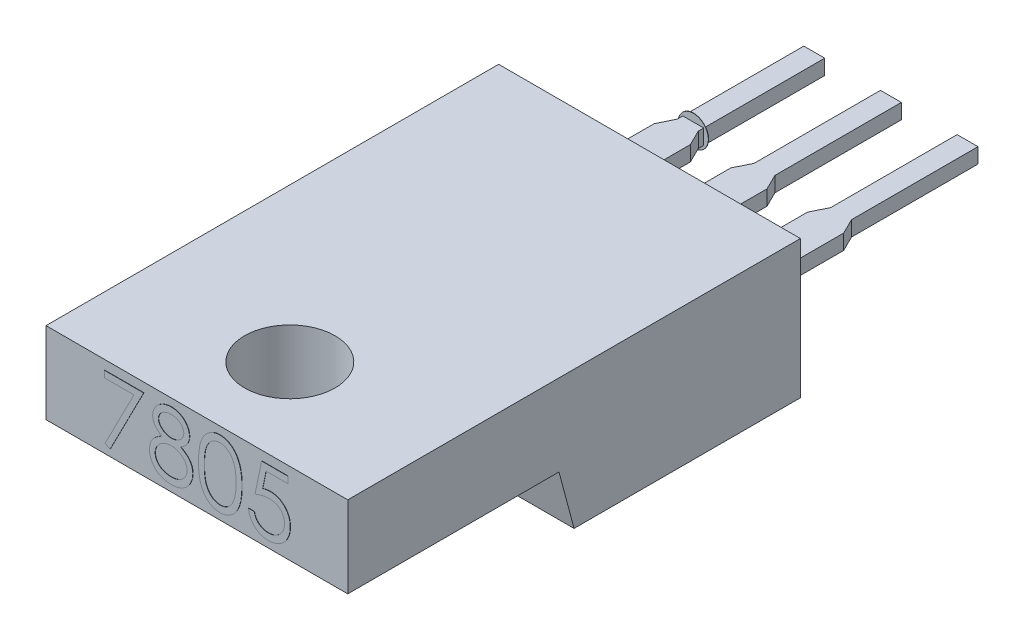
from build123d import *

# Parameters (mm, degrees)
SKETCH4_W                = 10
SKETCH4_H                = 15
BASE_EXTRUDE_DEPTH       = 4.572
CUT_EXTRUDE1_DEPTH       = 22.538261884
CUT_EXTRUDE1_DEPTH_BACK  = 22.538261884
SKETCH6_R                = 1.5
CUT_EXTRUDE2_DEPTH       = 21.414644254
BASE_FLANGIA1_DEPTH      = 0.5
SCHIZZO4_W               = 15.810041558
SCHIZZO4_H               = 21.877993277
TAGLIO_ESTRUSIONE1_DEPTH = 10
SCHIZZO5_R               = 0.5
SCHIZZO5_W               = 0.692
SCHIZZO5_H               = 0.5
ESTRUSIONE1_DEPTH        = 0.01
ESTRUSIONE2_DEPTH        = 0.01


# Sheet-metal steps are written as plain solids
with BuildPart() as part:
    # Sketch4 → Base-Extrude (new body)
    with BuildSketch(Plane(origin=(0, -1.397, 0), x_dir=(1, 0, 0), z_dir=(0, 1, 0))):
        with Locations((2.46, -11.31)):
            Rectangle(SKETCH4_W, SKETCH4_H)
    extrude(amount=BASE_EXTRUDE_DEPTH)

    # Sketch5 → Cut-Extrude1 (cut, two sides: drawn at the far end of the back side and taken through both)
    with BuildSketch(Plane.ZY.offset(2.54).offset(-CUT_EXTRUDE1_DEPTH_BACK)):
        Polygon((59.29212591, 0.475), (18.81, 0.475), (11.81, 0.475), (11.31, -1.397), (0.863664483, -40.508080175), (47.356906836, -106.792229776), (105.785368263, -65.809149601), align=None)
    extrude(amount=CUT_EXTRUDE1_DEPTH + CUT_EXTRUDE1_DEPTH_BACK, mode=Mode.SUBTRACT)

    # Sketch6 → Cut-Extrude2 (cut, through all)
    with BuildSketch(Plane.XZ.offset(-0.475)):
        with Locations(Location((2.54, 15.81, 0), (0, 0, 270))):
            Circle(SKETCH6_R)
    extrude(amount=-CUT_EXTRUDE2_DEPTH, mode=Mode.SUBTRACT)


with BuildPart() as body_2:
    # Schizzo1 → Base-Flangia1 (new body)
    with BuildSketch(Plane.XZ.offset(-0.254)):
        Polygon((2.114, -9.999924476), (2.114, 7.5524e-05), (1.86, 0.517), (1.86, 3.81), (1.86, 4.559138727), (0.52, 4.559138727), (0.52, 3.81), (0.52, 0.517), (0.266, 7.5524e-05), (0.266, -9.999924476), (-0.426, -9.999924476), (-0.426, 7.5524e-05), (-0.68, 0.517), (-0.68, 3.81), (-0.68, 5.228555054), (5.6, 5.228555054), (5.6, 3.81), (5.6, 0.517), (5.346, 7.5524e-05), (5.346, -9.999924476), (4.654, -9.999924476), (4.654, 7.5524e-05), (4.4, 0.517), (4.4, 3.81), (4.4, 4.676576991), (3.06, 4.676576991), (3.06, 3.81), (3.06, 0.517), (2.806, 7.5524e-05), (2.806, -9.999924476), align=None)
    extrude(amount=-BASE_FLANGIA1_DEPTH)

    # Schizzo4 → Taglio-Estrusione1 (cut)
    with BuildSketch(Plane(origin=(0, 0, -4.19), x_dir=(-1, 0, 0), z_dir=(0, 0, -1))):
        with Locations((-1.391629537, 1.771326868)):
            Rectangle(SCHIZZO4_W, SCHIZZO4_H)
    extrude(amount=TAGLIO_ESTRUSIONE1_DEPTH, mode=Mode.SUBTRACT)


with BuildPart() as part_1:
    add(part.part)

    # Abbina3: union body 2
    add(body_2.part)

    # Schizzo5 → Estrusione1 (add)
    with BuildSketch(Plane(origin=(0, 0, -0.19), x_dir=(-1, 0, 0), z_dir=(0, 0, -1))):
        with Locations((0.08, 0.504)):
            Circle(SCHIZZO5_R)
        with Locations((0.08, 0.504)):
            Rectangle(SCHIZZO5_W, SCHIZZO5_H, mode=Mode.SUBTRACT)
    extrude(amount=-ESTRUSIONE1_DEPTH)

    # Schizzo6 → Estrusione2 (add)
    # profile 1 of 4: a face of its own
    with BuildSketch(Plane.XY.offset(18.81)):
        Polygon((-0.595960558, 2.871521387), (0.706603545, 2.871521387), (-0.406003293, 0.700581216), (-0.570095841, 0.79089572), (0.385202637, 2.65442737), (-0.595960558, 2.65442737), align=None)
    # profile 2 of 4: a face of its own
    with BuildSketch(Plane.XY.offset(18.81)):
        with BuildLine():
            add(Edge.make_bspline(
                [(1.925637332, 1.934031403), (1.942962882, 1.924997497), (1.976753491, 1.907378361), (2.024878755, 1.87900848), (2.068860065, 1.849108468), (2.10991769, 1.819090591), (2.147330288, 1.787805259), (2.180679528, 1.755128065), (2.210789184, 1.721874659), (2.237052049, 1.687481947), (2.26015204, 1.652041297), (2.280116522, 1.615459689), (2.297181212, 1.577817292), (2.310705465, 1.538703209), (2.321846263, 1.498692003), (2.329511986, 1.457267033), (2.333634598, 1.414701265), (2.334414023, 1.385933768), (2.334808673, 1.371367808)],
                knots=[0, 0, 0, 0, 1.272397273, 2.481599622, 3.635517121, 4.734568067, 5.792894095, 6.808321871, 7.773003508, 8.711915296, 9.623354172, 10.525449501, 11.423591555, 12.311487226, 13.218079475, 14.126165749, 15.051214107, 16, 16, 16, 16], degree=3))
            add(Edge.make_bspline(
                [(2.334808673, 1.371367808), (2.334342147, 1.350988703), (2.333418718, 1.310650808), (2.325375394, 1.25111435), (2.313332783, 1.193291987), (2.295746602, 1.137196395), (2.27293898, 1.083137107), (2.24483156, 1.031067849), (2.213014307, 0.980135219), (2.187461763, 0.948796819), (2.174532231, 0.932939656)],
                knots=[0, 0, 0, 0, 1.025265484, 2.029385089, 3.018602448, 3.995076438, 4.983346944, 5.966715145, 6.97116228, 8, 8, 8, 8], degree=3))
            add(Edge.make_bspline(
                [(2.174532231, 0.932939656), (2.157697791, 0.914437707), (2.124236941, 0.877662443), (2.066915837, 0.829916001), (2.004007364, 0.789790415), (1.935754944, 0.757089793), (1.862341021, 0.731637868), (1.783781237, 0.713348346), (1.69992244, 0.7028724), (1.642285322, 0.701358083), (1.612716659, 0.700581216)],
                knots=[0, 0, 0, 0, 0.954267603, 1.896743057, 2.838368354, 3.796610408, 4.779680527, 5.799409237, 6.871065594, 8, 8, 8, 8], degree=3))
            add(Edge.make_bspline(
                [(1.612716659, 0.700581216), (1.584284753, 0.701278191), (1.52895915, 0.702634433), (1.448430339, 0.711823447), (1.373365435, 0.727926966), (1.303327978, 0.749967277), (1.238740196, 0.778639177), (1.17978613, 0.814325215), (1.125615204, 0.855588992), (1.077871385, 0.903615601), (1.035484564, 0.955055362), (0.998250551, 1.008124193), (0.967302418, 1.062826937), (0.941099841, 1.118347931), (0.921041084, 1.175465367), (0.907148367, 1.233885375), (0.898325305, 1.293505914), (0.897151381, 1.333741723), (0.89656081, 1.353983326)],
                knots=[0, 0, 0, 0, 1.256902934, 2.445805442, 3.576955095, 4.645999104, 5.686449165, 6.692658513, 7.68621702, 8.689161843, 9.678783111, 10.630372946, 11.551080876, 12.453998257, 13.34127905, 14.221779781, 15.105423033, 16, 16, 16, 16], degree=3))
            add(Edge.make_bspline(
                [(0.89656081, 1.353983326), (0.89691029, 1.36883579), (0.897600987, 1.398189501), (0.902381538, 1.441556571), (0.910067131, 1.483766614), (0.920504993, 1.52497554), (0.934650995, 1.564883338), (0.951730761, 1.603679101), (0.971646751, 1.641406627), (0.994676789, 1.678272236), (1.021468966, 1.71375937), (1.05180603, 1.748470281), (1.086294312, 1.781866363), (1.124550135, 1.814355639), (1.166136309, 1.846514442), (1.212133006, 1.876604811), (1.261320872, 1.906757009), (1.29627938, 1.924783948), (1.314212385, 1.934031403)],
                knots=[0, 0, 0, 0, 0.941657376, 1.861047343, 2.762797495, 3.66048619, 4.553285746, 5.444104102, 6.34607688, 7.256116206, 8.197091036, 9.162375105, 10.176350973, 11.237807142, 12.343728897, 13.50695164, 14.721116704, 16, 16, 16, 16], degree=3))
            add(Edge.make_bspline(
                [(1.314212385, 1.934031403), (1.289664268, 1.947417668), (1.242132243, 1.973337224), (1.179195009, 2.020960292), (1.125134966, 2.072539113), (1.081438065, 2.129162846), (1.047043908, 2.189062623), (1.023446942, 2.251863671), (1.007483354, 2.316401511), (1.005902007, 2.360492401), (1.005107818, 2.382635837)],
                knots=[0, 0, 0, 0, 1.166880483, 2.259407225, 3.286803203, 4.280235371, 5.237608625, 6.161067461, 7.076446754, 8, 8, 8, 8], degree=3))
            add(Edge.make_bspline(
                [(1.005107818, 2.382635837), (1.00609686, 2.405191979), (1.008085008, 2.45053376), (1.024161587, 2.518028891), (1.050359913, 2.584320814), (1.085993088, 2.649088221), (1.13037488, 2.710139065), (1.183622077, 2.76489478), (1.244463118, 2.812859344), (1.312594305, 2.853122077), (1.385913361, 2.885890289), (1.463271918, 2.908495336), (1.543322131, 2.923273368), (1.597809799, 2.924946535), (1.625437012, 2.925794892)],
                knots=[0, 0, 0, 0, 0.888701115, 1.786444228, 2.72001202, 3.692817113, 4.693886446, 5.687152267, 6.695133018, 7.739871481, 8.800368666, 9.853104506, 10.91144658, 12, 12, 12, 12], degree=3))
            add(Edge.make_bspline(
                [(1.625437012, 2.925794892), (1.652351223, 2.924920198), (1.705422983, 2.923195403), (1.78343402, 2.908810005), (1.858076684, 2.884783105), (1.929093571, 2.852188118), (1.99521332, 2.812039825), (2.053634716, 2.763416439), (2.105240611, 2.708902263), (2.147927364, 2.647869932), (2.183102064, 2.583351396), (2.207595466, 2.515846347), (2.223290231, 2.446813345), (2.225269837, 2.400102743), (2.226261664, 2.376699673)],
                knots=[0, 0, 0, 0, 1.072916533, 2.115669174, 3.151510826, 4.193348718, 5.225979165, 6.227137561, 7.216255879, 8.211077061, 9.189680878, 10.138522389, 11.067357538, 12, 12, 12, 12], degree=3))
            add(Edge.make_bspline(
                [(2.226261664, 2.376699673), (2.225394097, 2.353732833), (2.223690243, 2.308627265), (2.209357423, 2.242873608), (2.185219371, 2.181295518), (2.152263377, 2.123194256), (2.109309868, 2.069623541), (2.056932206, 2.019902152), (1.995547978, 1.973621641), (1.9494283, 1.947504173), (1.925637332, 1.934031403)],
                knots=[0, 0, 0, 0, 0.975232327, 1.915300861, 2.843280834, 3.77672583, 4.742871857, 5.749627742, 6.839139064, 8, 8, 8, 8], degree=3))
        make_face()
        with BuildLine():
            add(Edge.make_bspline(
                [(1.614836718, 2.708700874), (1.599989326, 2.708306908), (1.570941335, 2.707536137), (1.528348757, 2.703509247), (1.487846421, 2.695675635), (1.449011151, 2.685250319), (1.412375393, 2.671166631), (1.377441591, 2.654599173), (1.344804291, 2.634456934), (1.314069503, 2.611862304), (1.286401177, 2.58701088), (1.261845091, 2.561118774), (1.241447612, 2.533677466), (1.22412656, 2.505369553), (1.21155869, 2.475354871), (1.202145992, 2.444553636), (1.195783056, 2.412576618), (1.195306267, 2.390722633), (1.195065083, 2.379667755)],
                knots=[0, 0, 0, 0, 1.203892937, 2.355340988, 3.463153438, 4.544400666, 5.610487187, 6.640501085, 7.674077295, 8.714426146, 9.728707835, 10.68524104, 11.601827946, 12.495867327, 13.368432065, 14.231010473, 15.105153427, 16, 16, 16, 16], degree=3))
            add(Edge.make_bspline(
                [(1.195065083, 2.379667755), (1.195480776, 2.368612399), (1.196302246, 2.346765428), (1.202655347, 2.31450388), (1.212124017, 2.282801271), (1.227031798, 2.252411435), (1.244912405, 2.222280165), (1.266981059, 2.193160525), (1.293281567, 2.164951173), (1.322931495, 2.137892044), (1.355232758, 2.112553269), (1.389452632, 2.090556154), (1.42516164, 2.072150764), (1.461992892, 2.056832504), (1.500321762, 2.04492478), (1.539913391, 2.036477075), (1.580774433, 2.031226534), (1.608460784, 2.030599383), (1.622468929, 2.030282071)],
                knots=[0, 0, 0, 0, 0.873023192, 1.725219244, 2.590779336, 3.480155217, 4.391973325, 5.357036234, 6.360879153, 7.436073238, 8.526419356, 9.601555421, 10.645666583, 11.697338044, 12.750135903, 13.812665442, 14.89329948, 16, 16, 16, 16], degree=3))
            add(Edge.make_bspline(
                [(1.622468929, 2.030282071), (1.640460659, 2.030809948), (1.676266414, 2.031860488), (1.729049629, 2.041628102), (1.780371324, 2.056992633), (1.829682947, 2.078014137), (1.875708101, 2.104398604), (1.91673519, 2.135987144), (1.952414263, 2.172050365), (1.982374537, 2.212026841), (2.005603349, 2.254572802), (2.023686823, 2.29726917), (2.034246701, 2.340571471), (2.035624086, 2.369580064), (2.036304399, 2.383907872)],
                knots=[0, 0, 0, 0, 1.076279235, 2.141928126, 3.20205304, 4.278698113, 5.344010996, 6.36967002, 7.368914609, 8.37248503, 9.349703398, 10.264243087, 11.142681841, 12, 12, 12, 12], degree=3))
            add(Edge.make_bspline(
                [(2.036304399, 2.383907872), (2.035982728, 2.393963875), (2.035344256, 2.413923599), (2.030082794, 2.443398706), (2.021388838, 2.472203263), (2.009618308, 2.500575227), (1.99413048, 2.528116527), (1.975767376, 2.555260109), (1.953461035, 2.581395356), (1.928426049, 2.607131331), (1.900035254, 2.630949288), (1.868343364, 2.651895041), (1.833512858, 2.669682514), (1.795542912, 2.684129523), (1.754573363, 2.694980372), (1.71079291, 2.703106164), (1.663836507, 2.707686093), (1.631524229, 2.708355278), (1.614836718, 2.708700874)],
                knots=[0, 0, 0, 0, 0.814439003, 1.616544685, 2.417341072, 3.248991801, 4.09997495, 4.973547432, 5.9003056, 6.880240646, 7.880314356, 8.896779544, 9.951930927, 11.043077905, 12.18215768, 13.381699519, 14.647792085, 16, 16, 16, 16], degree=3))
        make_face(mode=Mode.SUBTRACT)
        with BuildLine():
            add(Edge.make_bspline(
                [(1.627133059, 1.813188054), (1.608309369, 1.812853233), (1.571381884, 1.812196395), (1.517281741, 1.804885126), (1.465361018, 1.79470735), (1.41579477, 1.779267272), (1.368603931, 1.759191299), (1.323533032, 1.73504041), (1.280926873, 1.706492357), (1.241373796, 1.673909832), (1.205255401, 1.638797686), (1.173566905, 1.601627728), (1.1466565, 1.563090768), (1.124985915, 1.522697372), (1.10719882, 1.481302865), (1.095518523, 1.437876366), (1.088030535, 1.393252731), (1.087025039, 1.362917815), (1.086518075, 1.34762315)],
                knots=[0, 0, 0, 0, 1.140299081, 2.23698856, 3.303958914, 4.344563908, 5.37730929, 6.408454204, 7.439741482, 8.480804886, 9.510774543, 10.48932336, 11.43758569, 12.353841022, 13.263987381, 14.161954604, 15.073269652, 16, 16, 16, 16], degree=3))
            add(Edge.make_bspline(
                [(1.086518075, 1.34762315), (1.087342522, 1.328614935), (1.088978205, 1.290903082), (1.101954363, 1.235166367), (1.122779663, 1.181208872), (1.151823484, 1.12947031), (1.187787206, 1.081119532), (1.232011308, 1.038974415), (1.281747434, 1.001526664), (1.338678422, 0.971239865), (1.400865161, 0.9470525), (1.468291111, 0.930387704), (1.53998861, 0.91935597), (1.589494173, 0.918244308), (1.614836718, 0.917675233)],
                knots=[0, 0, 0, 0, 0.898778495, 1.783155532, 2.693654817, 3.627872908, 4.583023416, 5.533784346, 6.509005473, 7.520592997, 8.575161974, 9.658835044, 10.801527049, 12, 12, 12, 12], degree=3))
            add(Edge.make_bspline(
                [(1.614836718, 0.917675233), (1.634642893, 0.918055513), (1.673231673, 0.918796419), (1.729526508, 0.925336492), (1.782651545, 0.935707932), (1.832503761, 0.950792838), (1.879641226, 0.969207824), (1.923264731, 0.992897607), (1.964496507, 1.019841154), (2.001304809, 1.051807754), (2.034828702, 1.085964401), (2.064058836, 1.122123141), (2.089433165, 1.159301261), (2.109348552, 1.198338936), (2.125269668, 1.238487212), (2.136713913, 1.280116307), (2.143775243, 1.323353901), (2.144489404, 1.352684291), (2.144851408, 1.367551702)],
                knots=[0, 0, 0, 0, 1.224942928, 2.386581632, 3.501229538, 4.569074225, 5.605009692, 6.626002462, 7.634866581, 8.645888296, 9.63523824, 10.59253846, 11.518950513, 12.414518923, 13.29783783, 14.186679152, 15.080837789, 16, 16, 16, 16], degree=3))
            add(Edge.make_bspline(
                [(2.144851408, 1.367551702), (2.144303585, 1.381991808), (2.143223375, 1.410465175), (2.136367375, 1.452657313), (2.124323012, 1.493419967), (2.107796443, 1.533243542), (2.085794623, 1.571321136), (2.059883678, 1.608644725), (2.028621044, 1.644178384), (1.993295331, 1.678198114), (1.954796817, 1.70965525), (1.913874305, 1.73748303), (1.870842797, 1.760918833), (1.825793351, 1.779978809), (1.778825995, 1.794969326), (1.729975277, 1.805441381), (1.679184001, 1.812033045), (1.644679389, 1.812798701), (1.627133059, 1.813188054)],
                knots=[0, 0, 0, 0, 0.917430815, 1.809013306, 2.70690318, 3.612392954, 4.541220862, 5.495268465, 6.494511384, 7.542276156, 8.608045339, 9.649016899, 10.681629292, 11.715607085, 12.752076957, 13.808767841, 14.885711793, 16, 16, 16, 16], degree=3))
        make_face(mode=Mode.SUBTRACT)
    # profile 3 of 4: a face of its own
    with BuildSketch(Plane.XY.offset(18.81)):
        with BuildLine():
            add(Edge.make_bspline(
                [(2.524765938, 1.81234003), (2.524964311, 1.846265593), (2.525349653, 1.912166489), (2.52963646, 2.008193391), (2.536757738, 2.098278899), (2.546517007, 2.182427325), (2.558393309, 2.260660392), (2.574247437, 2.332769031), (2.592277084, 2.399086984), (2.613173087, 2.459830508), (2.636751416, 2.515817976), (2.662414041, 2.568084645), (2.691179416, 2.616551433), (2.721403549, 2.661991906), (2.754309897, 2.703662236), (2.788962023, 2.742150894), (2.826712396, 2.776568348), (2.866277739, 2.807923016), (2.908016268, 2.835409125), (2.950738261, 2.859619401), (2.994737777, 2.880302178), (3.040134945, 2.896564489), (3.08652173, 2.909996763), (3.134060289, 2.91918246), (3.182829114, 2.924962114), (3.215747172, 2.925514665), (3.232441552, 2.925794892)],
                knots=[0, 0, 0, 0, 1.646270934, 3.197905019, 4.663502075, 6.030701355, 7.308322542, 8.50163776, 9.611534131, 10.641858119, 11.616356847, 12.558055219, 13.465016945, 14.349605745, 15.204443733, 16.039544428, 16.859896111, 17.680448484, 18.487036065, 19.28249412, 20.06191084, 20.843045899, 21.620316918, 22.403196591, 23.190181807, 24, 24, 24, 24], degree=3))
            add(Edge.make_bspline(
                [(3.232441552, 2.925794892), (3.249275389, 2.925499879), (3.282752594, 2.924913193), (3.332246536, 2.919274428), (3.380597058, 2.909918082), (3.427598027, 2.896661112), (3.473635519, 2.880214203), (3.518349442, 2.859599613), (3.562017534, 2.835603345), (3.603945851, 2.807407001), (3.644594689, 2.7759701), (3.6829656, 2.740432677), (3.719062076, 2.701153561), (3.753337142, 2.658553005), (3.784818384, 2.61181393), (3.814798507, 2.561749254), (3.841633024, 2.507483445), (3.867477328, 2.449921924), (3.889785172, 2.387471997), (3.90990333, 2.32048569), (3.926158706, 2.248171777), (3.939698885, 2.170909666), (3.950188417, 2.088415617), (3.957828158, 2.000866464), (3.961863786, 1.908204609), (3.962623791, 1.844851053), (3.963013801, 1.81234003)],
                knots=[0, 0, 0, 0, 0.810914788, 1.612654377, 2.396697861, 3.181598691, 3.963628158, 4.749916497, 5.551656086, 6.361998678, 7.18212741, 8.025565596, 8.878627764, 9.750805457, 10.657531673, 11.591944965, 12.560506719, 13.57287815, 14.630710178, 15.753379473, 16.941251878, 18.199788006, 19.531962791, 20.947069417, 22.433333509, 24, 24, 24, 24], degree=3))
            add(Edge.make_bspline(
                [(3.963013801, 1.81234003), (3.962619748, 1.77997081), (3.96185195, 1.716900704), (3.957873399, 1.624655781), (3.950036513, 1.53757125), (3.940233329, 1.455438256), (3.926655842, 1.378598648), (3.909961289, 1.306786529), (3.891425142, 1.239691781), (3.868544099, 1.177864062), (3.843500479, 1.120440877), (3.816252813, 1.066818363), (3.787061061, 1.016522558), (3.755257392, 0.969956044), (3.721358423, 0.926788952), (3.684638617, 0.887783247), (3.646133073, 0.851999078), (3.605364612, 0.82015738), (3.562782388, 0.792287046), (3.519264279, 0.767362479), (3.474038138, 0.747264611), (3.428128876, 0.730007705), (3.380879817, 0.716823622), (3.332349857, 0.707707529), (3.282785847, 0.701314078), (3.249281091, 0.700826349), (3.232441552, 0.700581216)],
                knots=[0, 0, 0, 0, 1.561518951, 3.042555995, 4.452378317, 5.7783523, 7.031515105, 8.214008947, 9.334062868, 10.386615937, 11.391082383, 12.354592575, 13.286541444, 14.194233754, 15.072674879, 15.931287219, 16.775624067, 17.606195743, 18.42308326, 19.229000347, 20.022332153, 20.807536673, 21.593273796, 22.3848459, 23.188221202, 24, 24, 24, 24], degree=3))
            add(Edge.make_bspline(
                [(3.232441552, 0.700581216), (3.215747636, 0.70086325), (3.182830491, 0.701419366), (3.134054976, 0.707172909), (3.086712737, 0.716423046), (3.040570157, 0.729374993), (2.995390502, 0.745228727), (2.951789415, 0.765883574), (2.909282101, 0.78967132), (2.86798197, 0.816761885), (2.828665091, 0.847799283), (2.791110221, 0.882128163), (2.756260804, 0.920605178), (2.723824946, 0.962622779), (2.69299776, 1.007794407), (2.664640853, 1.056736804), (2.638411813, 1.109255906), (2.61443694, 1.165691024), (2.593180367, 1.226865671), (2.574403896, 1.293479698), (2.559578667, 1.366121059), (2.546888975, 1.444206323), (2.536653753, 1.528071034), (2.529666138, 1.617760719), (2.525347342, 1.713219488), (2.524963276, 1.778696923), (2.524765938, 1.81234003)],
                knots=[0, 0, 0, 0, 0.810891512, 1.598919785, 2.382837074, 3.152667961, 3.926044502, 4.706494248, 5.493654104, 6.291793342, 7.103789334, 7.925228297, 8.761435821, 9.622817696, 10.50288917, 11.416980706, 12.369136599, 13.353924996, 14.394355917, 15.514179734, 16.714354668, 17.994756427, 19.357759367, 20.818452758, 22.365282078, 24, 24, 24, 24], degree=3))
        make_face()
        with BuildLine():
            add(Edge.make_bspline(
                [(2.714723203, 1.813188054), (2.71479544, 1.784916222), (2.714935638, 1.730046147), (2.718598197, 1.650312365), (2.723587623, 1.575944595), (2.730023074, 1.506848409), (2.739580096, 1.443257687), (2.750288486, 1.384735069), (2.76331995, 1.331590264), (2.778738366, 1.283458588), (2.796300105, 1.239523199), (2.815474604, 1.198640559), (2.836073231, 1.160327721), (2.859126241, 1.124928825), (2.88423297, 1.09232843), (2.910826322, 1.061949527), (2.93989879, 1.034858019), (2.98011772, 1.002366064), (3.033213683, 0.968790207), (3.10011272, 0.939552334), (3.168855069, 0.921178181), (3.215513206, 0.918841529), (3.238801728, 0.917675233)],
                knots=[0, 0, 0, 0, 1.459021318, 2.831673884, 4.118529203, 5.306027144, 6.411944654, 7.436330062, 8.375795394, 9.233974572, 10.042671642, 10.816086306, 11.563610507, 12.285937304, 12.993564865, 13.685989202, 14.367179055, 15.041617293, 16.353048772, 17.594441528, 18.799311195, 20, 20, 20, 20], degree=3))
            add(Edge.make_bspline(
                [(3.238801728, 0.917675233), (3.262240892, 0.91864151), (3.309070825, 0.920572069), (3.377489835, 0.939197972), (3.443910998, 0.96730098), (3.495964029, 1.000531138), (3.535565376, 1.032177318), (3.563938985, 1.059158558), (3.589981271, 1.089369963), (3.614681002, 1.121966204), (3.637334824, 1.15757004), (3.657934912, 1.196010264), (3.676732937, 1.237393624), (3.687442693, 1.266282942), (3.692918315, 1.281053305)],
                knots=[0, 0, 0, 0, 1.353760809, 2.704726607, 4.075137775, 5.516104923, 6.260822281, 7.007110065, 7.778089737, 8.566572457, 9.372053459, 10.217411131, 11.088608312, 12, 12, 12, 12], degree=3))
            add(Edge.make_bspline(
                [(3.692918315, 1.281053305), (3.699299622, 1.299939862), (3.712256412, 1.338287672), (3.728954962, 1.397774261), (3.742105751, 1.460187361), (3.753936929, 1.525153979), (3.762012348, 1.593153227), (3.768512217, 1.663974707), (3.772340775, 1.737671817), (3.772815362, 1.787743073), (3.773056536, 1.813188054)],
                knots=[0, 0, 0, 0, 0.884706709, 1.796334032, 2.740027952, 3.714592787, 4.726048262, 5.777819803, 6.87074269, 8, 8, 8, 8], degree=3))
            add(Edge.make_bspline(
                [(3.773056536, 1.813188054), (3.772723803, 1.838628919), (3.772072905, 1.88839669), (3.769584922, 1.961281495), (3.763160189, 2.030507236), (3.756024531, 2.096372141), (3.745503354, 2.15851161), (3.734159347, 2.217445842), (3.718918614, 2.272444719), (3.70263856, 2.324369323), (3.684005606, 2.372629719), (3.663494662, 2.417450913), (3.641589123, 2.459049294), (3.617796434, 2.497310731), (3.592399045, 2.532406602), (3.564726622, 2.563633238), (3.535876835, 2.591958452), (3.495468346, 2.624290577), (3.442567228, 2.657257173), (3.376741527, 2.687595514), (3.308239757, 2.705017672), (3.261931049, 2.707474025), (3.238801728, 2.708700874)],
                knots=[0, 0, 0, 0, 1.31362396, 2.569729283, 3.763502607, 4.902122613, 5.988968491, 7.01645872, 7.998833611, 8.933434873, 9.825090667, 10.667526885, 11.477055099, 12.250526234, 12.991942729, 13.710640831, 14.402115721, 15.076753259, 16.378508321, 17.609869233, 18.806226677, 20, 20, 20, 20], degree=3))
            add(Edge.make_bspline(
                [(3.238801728, 2.708700874), (3.215391037, 2.707472333), (3.168527006, 2.705013012), (3.099313242, 2.687660425), (3.03296823, 2.657414488), (2.980207002, 2.624181387), (2.939770331, 2.59252917), (2.911296512, 2.565081172), (2.884598589, 2.535057008), (2.860004313, 2.502156803), (2.836969366, 2.466799176), (2.815814182, 2.42870597), (2.796753701, 2.387684145), (2.779164482, 2.343768492), (2.763699034, 2.295640968), (2.750942209, 2.242561624), (2.739157181, 2.184225147), (2.730814328, 2.120290016), (2.723397676, 2.051176523), (2.718631337, 1.976623097), (2.714923386, 1.896755591), (2.714791267, 1.841601814), (2.714723203, 1.813188054)],
                knots=[0, 0, 0, 0, 1.207732386, 2.417664972, 3.655092373, 4.956220595, 5.625982001, 6.301752483, 6.994047911, 7.697131622, 8.419323945, 9.170223765, 9.943494443, 10.752040957, 11.610060368, 12.549350801, 13.567764191, 14.679664412, 15.874934091, 17.154273443, 18.533957287, 20, 20, 20, 20], degree=3))
        make_face(mode=Mode.SUBTRACT)
    # profile 4 of 4: a face of its own
    with BuildSketch(Plane.XY.offset(18.81)):
        with BuildLine():
            Line((5.482671921, 2.871521387), (5.482671921, 2.65442737))
            Line((5.482671921, 2.65442737), (4.762699966, 2.65442737))
            Line((4.762699966, 2.65442737), (4.648640804, 2.09769994))
            add(Edge.make_bspline(
                [(4.648640804, 2.09769994), (4.671050785, 2.103886818), (4.71446658, 2.115872917), (4.778547067, 2.129181169), (4.839381399, 2.137203604), (4.878857457, 2.138299016), (4.897959715, 2.13882908)],
                knots=[0, 0, 0, 0, 1.100273476, 2.13160584, 3.095893838, 4, 4, 4, 4], degree=3))
            add(Edge.make_bspline(
                [(4.897959715, 2.13882908), (4.921596071, 2.13831749), (4.968071055, 2.137311577), (5.036069846, 2.127652411), (5.100980691, 2.112448748), (5.162667839, 2.091209194), (5.22124541, 2.064049499), (5.276174459, 2.030122392), (5.328279483, 1.99049033), (5.376625718, 1.944924537), (5.420485657, 1.894776702), (5.459048898, 1.840857418), (5.491804369, 1.783690689), (5.518148255, 1.722730321), (5.539184495, 1.658650261), (5.553185939, 1.590776271), (5.562509378, 1.519748122), (5.563551011, 1.471182977), (5.564082177, 1.446417888)],
                knots=[0, 0, 0, 0, 1.052922333, 2.070308379, 3.05430497, 4.020497103, 4.973039431, 5.925935799, 6.892292201, 7.88610001, 8.88166317, 9.857072816, 10.836096531, 11.812156883, 12.81219415, 13.836441305, 14.89672472, 16, 16, 16, 16], degree=3))
            add(Edge.make_bspline(
                [(5.564082177, 1.446417888), (5.563679965, 1.429168736), (5.562880976, 1.394903539), (5.55881783, 1.344016332), (5.550994802, 1.294206428), (5.540491464, 1.245467219), (5.526858668, 1.19789098), (5.510355288, 1.151341532), (5.490158643, 1.106108603), (5.468005383, 1.061764198), (5.443061084, 1.019310815), (5.415375987, 0.979608809), (5.38612638, 0.9420626), (5.354653733, 0.907074867), (5.320665512, 0.874875518), (5.284573342, 0.845273462), (5.246665221, 0.817768086), (5.20635467, 0.793475892), (5.16453993, 0.771122104), (5.120617151, 0.752783584), (5.075586156, 0.736388169), (5.028798826, 0.72331955), (4.98036114, 0.713079386), (4.930193252, 0.706124261), (4.878558275, 0.701058511), (4.843557672, 0.7007414), (4.825877717, 0.700581216)],
                knots=[0, 0, 0, 0, 1.056347294, 2.098418968, 3.122841568, 4.141288669, 5.149314143, 6.15115421, 7.162517403, 8.180376062, 9.185164535, 10.17417709, 11.141909838, 12.097768115, 13.052685741, 14.0056014, 14.954263652, 15.917497458, 16.885230207, 17.854509472, 18.828990115, 19.81800267, 20.826176721, 21.857883937, 22.917946725, 24, 24, 24, 24], degree=3))
            add(Edge.make_bspline(
                [(4.825877717, 0.700581216), (4.804787141, 0.700999009), (4.763293924, 0.701820966), (4.702502914, 0.710419764), (4.644013605, 0.722735085), (4.58829683, 0.741262734), (4.534853256, 0.764477908), (4.484402374, 0.79381864), (4.435655072, 0.827067907), (4.39059303, 0.866305073), (4.348770047, 0.909192176), (4.311331349, 0.955733226), (4.277988662, 1.005160079), (4.24927593, 1.057712772), (4.224784269, 1.113253217), (4.205543776, 1.171989508), (4.190014485, 1.233614749), (4.183444703, 1.276040919), (4.180107818, 1.297589763)],
                knots=[0, 0, 0, 0, 1.0467383, 2.05933395, 3.04377827, 4.011590433, 4.970194871, 5.932262533, 6.905835911, 7.896367577, 8.894135286, 9.877477877, 10.858688626, 11.851381753, 12.8477658, 13.868841284, 14.917554742, 16, 16, 16, 16], degree=3))
            Line((4.180107818, 1.297589763), (4.370065083, 1.297589763))
            add(Edge.make_bspline(
                [(4.370065083, 1.297589763), (4.37473902, 1.277404956), (4.383722587, 1.238608637), (4.403441302, 1.184100635), (4.427550664, 1.135526628), (4.456219008, 1.092244071), (4.490418313, 1.054501487), (4.529443253, 1.020866406), (4.5731964, 0.9905224), (4.621815162, 0.965229583), (4.673106882, 0.94365848), (4.726789909, 0.92929436), (4.781402537, 0.919194296), (4.818340409, 0.918183279), (4.836902022, 0.917675233)],
                knots=[0, 0, 0, 0, 1.136247022, 2.183929868, 3.172523383, 4.106158343, 5.02341133, 5.958108904, 6.928429099, 7.938127109, 8.96079061, 9.975095812, 10.982467395, 12, 12, 12, 12], degree=3))
            add(Edge.make_bspline(
                [(4.836902022, 0.917675233), (4.855019748, 0.918171609), (4.890693699, 0.919148975), (4.943193918, 0.926671616), (4.993880752, 0.938257385), (5.042254058, 0.955595822), (5.089160322, 0.97666858), (5.133413031, 1.003710554), (5.17629239, 1.034831613), (5.216465595, 1.070486337), (5.253258976, 1.109777533), (5.28576863, 1.151794814), (5.312848002, 1.196617859), (5.335668153, 1.243470671), (5.352996577, 1.292866751), (5.365358503, 1.344574604), (5.372617496, 1.398721949), (5.373616067, 1.435654341), (5.374124912, 1.454474112)],
                knots=[0, 0, 0, 0, 1.027316725, 2.022795036, 3.002884548, 3.971462791, 4.93288096, 5.914575861, 6.907176829, 7.935150275, 8.956128384, 9.956726525, 10.942570165, 11.921478529, 12.907843606, 13.90538589, 14.932640048, 16, 16, 16, 16], degree=3))
            add(Edge.make_bspline(
                [(5.374124912, 1.454474112), (5.373726689, 1.471453257), (5.372947223, 1.504687517), (5.366578736, 1.553309894), (5.355501329, 1.599315972), (5.340125935, 1.642927914), (5.320604518, 1.684186853), (5.296748891, 1.72313537), (5.26811136, 1.759260117), (5.235398646, 1.792577995), (5.199561641, 1.823327038), (5.159983758, 1.84953989), (5.117493231, 1.871591879), (5.072601997, 1.890622525), (5.024242273, 1.904290595), (4.973371738, 1.914552126), (4.919441062, 1.920488083), (4.882568313, 1.921311701), (4.863614763, 1.921735062)],
                knots=[0, 0, 0, 0, 1.045622112, 2.046656509, 3.013763289, 3.955457236, 4.890082067, 5.820317437, 6.762574623, 7.722996705, 8.69280354, 9.665887285, 10.63943826, 11.638615906, 12.663482002, 13.728887084, 14.832589034, 16, 16, 16, 16], degree=3))
            add(Edge.make_bspline(
                [(4.863614763, 1.921735062), (4.84720822, 1.921383943), (4.813332872, 1.920658971), (4.761370019, 1.915321042), (4.706765025, 1.906709659), (4.649727211, 1.894864642), (4.590085285, 1.879363944), (4.527965109, 1.860788984), (4.463236072, 1.838580918), (4.419622019, 1.821809531), (4.397201835, 1.813188054)],
                knots=[0, 0, 0, 0, 0.817624296, 1.688186739, 2.600797293, 3.572016777, 4.590301741, 5.671205678, 6.80286297, 8, 8, 8, 8], degree=3))
            Line((4.397201835, 1.813188054), (4.614295852, 2.871521387))
            Line((4.614295852, 2.871521387), (5.482671921, 2.871521387))
        make_face()
    extrude(amount=ESTRUSIONE2_DEPTH)


solid = part_1.part
